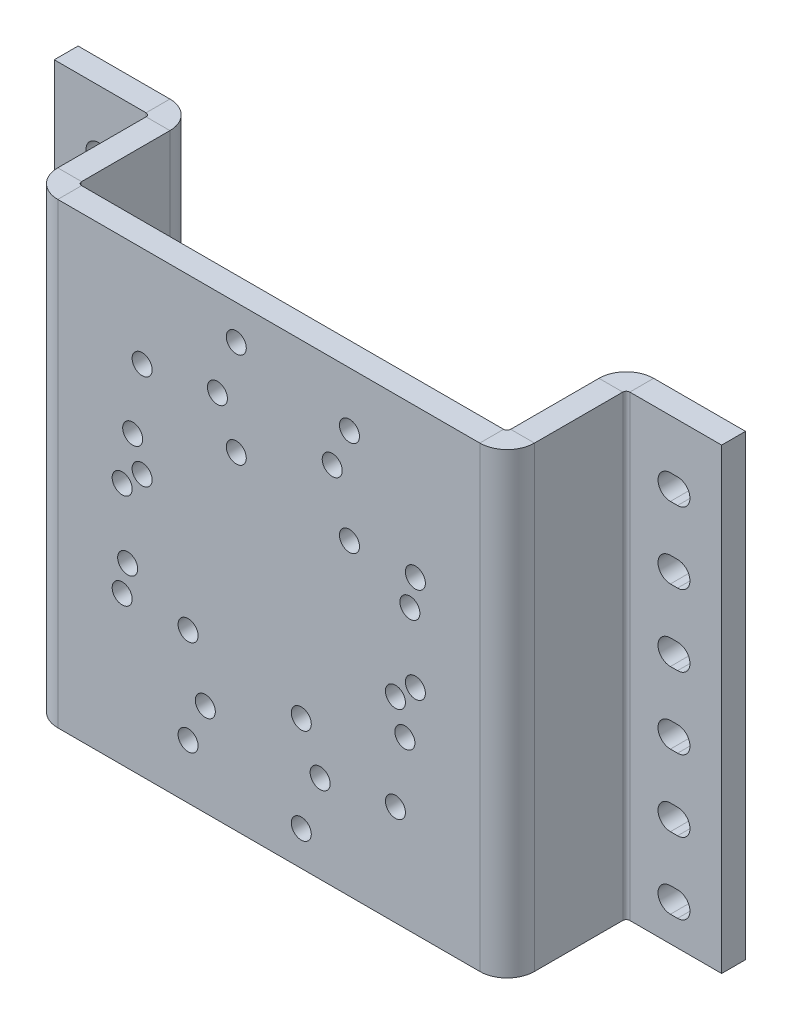
from build123d import *

# Parameters (mm, degrees)
ESBO_O1_W                      = 100
ESBO_O1_H                      = 96
FLANGE_BASE1_DEPTH             = 5
ARESTA_FLANGE1_STRIP_W         = 21.4732
ARESTA_FLANGE1_STRIP_H         = 5
ARESTA_FLANGE1_STRIP_CUT_DEPTH = 96
ARESTA_FLANGE1_DEPTH           = 96
ARESTA_FLANGE2_STRIP_W         = 21.4732
ARESTA_FLANGE2_STRIP_H         = 5
ARESTA_FLANGE2_STRIP_CUT_DEPTH = 96
ARESTA_FLANGE2_DEPTH           = 96
ARESTA_FLANGE3_STRIP_W         = 21.4732
ARESTA_FLANGE3_STRIP_H         = 5
ARESTA_FLANGE3_STRIP_CUT_DEPTH = 96
ARESTA_FLANGE3_DEPTH           = 96
ARESTA_FLANGE4_STRIP_W         = 21.4732
ARESTA_FLANGE4_STRIP_H         = 5
ARESTA_FLANGE4_STRIP_CUT_DEPTH = 96
ARESTA_FLANGE4_DEPTH           = 96
FURO_DE_DI_METRO_4_2_4_2_1_D   = 4.2
PADR_OCIRCULAR1_COUNT          = 8
FURO_DE_DI_METRO_4_2_4_2_2_D   = 4.2
PADR_OCIRCULAR2_COUNT          = 8
FURO_DE_DI_METRO_4_2_4_2_3_D   = 4.2
PADR_OCIRCULAR3_COUNT          = 8
CORTE_EXTRUS_O1_REACH          = 90.482
PADR_O_LINEAR2_COUNT           = 6
PADR_O_LINEAR2_PITCH           = 15
ESPELHAR2_COPY_1_REACH         = 90.482
ESPELHAR2_COPY_2_REACH         = 90.482
ESPELHAR2_COPY_3_REACH         = 90.482
ESPELHAR2_COPY_4_REACH         = 90.482
ESPELHAR2_COPY_5_REACH         = 90.482


# Sheet-metal steps are written as plain solids
with BuildPart() as part:
    # Esboço1 → Flange-base1 (new body)
    with BuildSketch(Plane.XY):
        Rectangle(ESBO_O1_W, ESBO_O1_H)
    extrude(amount=-FLANGE_BASE1_DEPTH)

    # Aresta-Flange1 strip (across the edge) → Aresta-Flange1 strip cut (cut)
    with BuildSketch(Plane(origin=(50, 48, -5), x_dir=(-1, 0, 0), z_dir=(0, -1, 0))):
        with Locations((-5, -2.5)):
            Rectangle(ARESTA_FLANGE1_STRIP_W, ARESTA_FLANGE1_STRIP_H)
    extrude(amount=ARESTA_FLANGE1_STRIP_CUT_DEPTH, mode=Mode.SUBTRACT)

    # Aresta-Flange1 section (across the edge) → Aresta-Flange1 (add)
    with BuildSketch(Plane(origin=(50, 48, -5), x_dir=(-1, 0, 0), z_dir=(0, -1, 0))):
        with BuildLine():
            Line((0, 0.7366), (0, 25))
            Line((0, 25), (5, 25))
            Line((5, 25), (5, 0.7366))
            ThreePointArc((5, 0.7366), (5.215745145, 0.215745145), (5.7366, 0))
            Line((5.7366, 0), (5.7366, -5))
            ThreePointArc((5.7366, -5), (1.680211239, -3.319788761), (0, 0.7366))
        make_face()
    extrude(amount=ARESTA_FLANGE1_DEPTH)

    # Aresta-Flange2 strip (across the edge) → Aresta-Flange2 strip cut (cut)
    with BuildSketch(Plane(origin=(50, -48, -30), x_dir=(0, 0, 1), z_dir=(0, 1, 0))):
        with Locations((-5, -2.5)):
            Rectangle(ARESTA_FLANGE2_STRIP_W, ARESTA_FLANGE2_STRIP_H)
    extrude(amount=ARESTA_FLANGE2_STRIP_CUT_DEPTH, mode=Mode.SUBTRACT)

    # Aresta-Flange2 section (across the edge) → Aresta-Flange2 (add)
    with BuildSketch(Plane(origin=(50, -48, -30), x_dir=(0, 0, 1), z_dir=(0, 1, 0))):
        with BuildLine():
            Line((0, 0.7366), (0, 20))
            Line((0, 20), (5, 20))
            Line((5, 20), (5, 0.7366))
            ThreePointArc((5, 0.7366), (5.215745145, 0.215745145), (5.7366, 0))
            Line((5.7366, 0), (5.7366, -5))
            ThreePointArc((5.7366, -5), (1.680211239, -3.319788761), (0, 0.7366))
        make_face()
    extrude(amount=ARESTA_FLANGE2_DEPTH)

    # Aresta-Flange3 strip (across the edge) → Aresta-Flange3 strip cut (cut)
    with BuildSketch(Plane(origin=(-50, -48, -5), x_dir=(1, 0, 0), z_dir=(0, 1, 0))):
        with Locations((-5, -2.5)):
            Rectangle(ARESTA_FLANGE3_STRIP_W, ARESTA_FLANGE3_STRIP_H)
    extrude(amount=ARESTA_FLANGE3_STRIP_CUT_DEPTH, mode=Mode.SUBTRACT)

    # Aresta-Flange3 section (across the edge) → Aresta-Flange3 (add)
    with BuildSketch(Plane(origin=(-50, -48, -5), x_dir=(1, 0, 0), z_dir=(0, 1, 0))):
        with BuildLine():
            Line((0, 0.7366), (0, 25))
            Line((0, 25), (5, 25))
            Line((5, 25), (5, 0.7366))
            ThreePointArc((5, 0.7366), (5.215745145, 0.215745145), (5.7366, 0))
            Line((5.7366, 0), (5.7366, -5))
            ThreePointArc((5.7366, -5), (1.680211239, -3.319788761), (0, 0.7366))
        make_face()
    extrude(amount=ARESTA_FLANGE3_DEPTH)

    # Aresta-Flange4 strip (across the edge) → Aresta-Flange4 strip cut (cut)
    with BuildSketch(Plane(origin=(-50, 48, -30), x_dir=(0, 0, 1), z_dir=(0, -1, 0))):
        with Locations((-5, -2.5)):
            Rectangle(ARESTA_FLANGE4_STRIP_W, ARESTA_FLANGE4_STRIP_H)
    extrude(amount=ARESTA_FLANGE4_STRIP_CUT_DEPTH, mode=Mode.SUBTRACT)

    # Aresta-Flange4 section (across the edge) → Aresta-Flange4 (add)
    with BuildSketch(Plane(origin=(-50, 48, -30), x_dir=(0, 0, 1), z_dir=(0, -1, 0))):
        with BuildLine():
            Line((0, 0.7366), (0, 20))
            Line((0, 20), (5, 20))
            Line((5, 20), (5, 0.7366))
            ThreePointArc((5, 0.7366), (5.215745145, 0.215745145), (5.7366, 0))
            Line((5.7366, 0), (5.7366, -5))
            ThreePointArc((5.7366, -5), (1.680211239, -3.319788761), (0, 0.7366))
        make_face()
    extrude(amount=ARESTA_FLANGE4_DEPTH)

    # Furo de diâmetro Ø4.2 (4.2)1 (through all)
    with Locations(Plane(origin=(-10.773634515, 29.600317555, 0), x_dir=(1, 0, 0), z_dir=(0, 0, 1))):
        with Locations((0, 0)):
            furo_de_di_metro_4_2_4_2_1 = Hole(FURO_DE_DI_METRO_4_2_4_2_1_D / 2)

    # PadrãoCircular1: Furo de diâmetro Ø4.2 (4.2)1 ×8 about axis
    padr_ocircular1_axis = Axis((0, 0, 0), (0, 0, 1))
    for i in range(1, PADR_OCIRCULAR1_COUNT):
        add(furo_de_di_metro_4_2_4_2_1.rotate(padr_ocircular1_axis, i * 360 / PADR_OCIRCULAR1_COUNT), mode=Mode.SUBTRACT)

    # Furo de diâmetro Ø4.2 (4.2)2 (through all)
    with Locations(Plane(origin=(-6.817847839, 40.753324224, 0), x_dir=(1, 0, 0), z_dir=(0, 0, 1))):
        with Locations((0, 0)):
            furo_de_di_metro_4_2_4_2_2 = Hole(FURO_DE_DI_METRO_4_2_4_2_2_D / 2)

    # PadrãoCircular2: Furo de diâmetro Ø4.2 (4.2)2 ×8 about axis
    padr_ocircular2_axis = Axis((0, 10, 0), (0, 0, 1))
    for i in range(1, PADR_OCIRCULAR2_COUNT):
        add(furo_de_di_metro_4_2_4_2_2.rotate(padr_ocircular2_axis, i * 360 / PADR_OCIRCULAR2_COUNT), mode=Mode.SUBTRACT)

    # Furo de diâmetro Ø4.2 (4.2)3 (through all)
    with Locations(Plane(origin=(-6.817847839, 20.753324224, 0), x_dir=(1, 0, 0), z_dir=(0, 0, 1))):
        with Locations((0, 0)):
            furo_de_di_metro_4_2_4_2_3 = Hole(FURO_DE_DI_METRO_4_2_4_2_3_D / 2)

    # PadrãoCircular3: Furo de diâmetro Ø4.2 (4.2)3 ×8 about axis
    padr_ocircular3_axis = Axis((0, -10, 0), (0, 0, 1))
    for i in range(1, PADR_OCIRCULAR3_COUNT):
        add(furo_de_di_metro_4_2_4_2_3.rotate(padr_ocircular3_axis, i * 360 / PADR_OCIRCULAR3_COUNT), mode=Mode.SUBTRACT)

    # Esboço24 → Corte-extrusão1 (cut, up to next)
    with BuildSketch(Plane.XY.offset(-25), mode=Mode.PRIVATE) as corte_extrus_o1_sk1:
        with BuildLine():
            Line((-60.75, -37.4), (-59.25, -37.4))
            ThreePointArc((-59.25, -37.4), (-56.65, -40), (-59.25, -42.6))
            Line((-59.25, -42.6), (-60.75, -42.6))
            ThreePointArc((-60.75, -42.6), (-63.35, -40), (-60.75, -37.4))
        make_face()
    corte_extrus_o1_tool1 = extrude(corte_extrus_o1_sk1.sketch, amount=-CORTE_EXTRUS_O1_REACH, mode=Mode.PRIVATE) & part.part
    corte_extrus_o1 = corte_extrus_o1_tool1.solids().sort_by_distance((-60, -40, -25))[0]
    add(corte_extrus_o1, mode=Mode.SUBTRACT)

    # Padrão linear2: Corte-extrusão1 ×6
    with Locations(*[(0, i * PADR_O_LINEAR2_PITCH, 0) for i in range(1, PADR_O_LINEAR2_COUNT)]):
        add(corte_extrus_o1, mode=Mode.SUBTRACT)

    # Espelhar2: Corte-extrusão1 across plane
    add(corte_extrus_o1.mirror(Plane(origin=(0, 0, 0), x_dir=(0, 0, 1), z_dir=(1, 0, 0))), mode=Mode.SUBTRACT)

    # Espelhar2 copy 1 sketch → Espelhar2 copy 1 (cut, up to next)
    with BuildSketch(Plane(origin=(0, 15, -25), x_dir=(-1, 0, 0), z_dir=(0, 0, 1)), mode=Mode.PRIVATE) as espelhar2_copy_1_sk1:
        with BuildLine():
            Line((-60.75, 37.4), (-59.25, 37.4))
            ThreePointArc((-59.25, 37.4), (-56.65, 40), (-59.25, 42.6))
            Line((-59.25, 42.6), (-60.75, 42.6))
            ThreePointArc((-60.75, 42.6), (-63.35, 40), (-60.75, 37.4))
        make_face()
    espelhar2_copy_1_tool1 = extrude(espelhar2_copy_1_sk1.sketch, amount=-ESPELHAR2_COPY_1_REACH, mode=Mode.PRIVATE) & part.part
    add(espelhar2_copy_1_tool1.solids().sort_by_distance((60, -25, -25))[0], mode=Mode.SUBTRACT)

    # Espelhar2 copy 2 sketch → Espelhar2 copy 2 (cut, up to next)
    with BuildSketch(Plane(origin=(0, 30, -25), x_dir=(-1, 0, 0), z_dir=(0, 0, 1)), mode=Mode.PRIVATE) as espelhar2_copy_2_sk1:
        with BuildLine():
            Line((-60.75, 37.4), (-59.25, 37.4))
            ThreePointArc((-59.25, 37.4), (-56.65, 40), (-59.25, 42.6))
            Line((-59.25, 42.6), (-60.75, 42.6))
            ThreePointArc((-60.75, 42.6), (-63.35, 40), (-60.75, 37.4))
        make_face()
    espelhar2_copy_2_tool1 = extrude(espelhar2_copy_2_sk1.sketch, amount=-ESPELHAR2_COPY_2_REACH, mode=Mode.PRIVATE) & part.part
    add(espelhar2_copy_2_tool1.solids().sort_by_distance((60, -10, -25))[0], mode=Mode.SUBTRACT)

    # Espelhar2 copy 3 sketch → Espelhar2 copy 3 (cut, up to next)
    with BuildSketch(Plane(origin=(0, 45, -25), x_dir=(-1, 0, 0), z_dir=(0, 0, 1)), mode=Mode.PRIVATE) as espelhar2_copy_3_sk1:
        with BuildLine():
            Line((-60.75, 37.4), (-59.25, 37.4))
            ThreePointArc((-59.25, 37.4), (-56.65, 40), (-59.25, 42.6))
            Line((-59.25, 42.6), (-60.75, 42.6))
            ThreePointArc((-60.75, 42.6), (-63.35, 40), (-60.75, 37.4))
        make_face()
    espelhar2_copy_3_tool1 = extrude(espelhar2_copy_3_sk1.sketch, amount=-ESPELHAR2_COPY_3_REACH, mode=Mode.PRIVATE) & part.part
    add(espelhar2_copy_3_tool1.solids().sort_by_distance((60, 5, -25))[0], mode=Mode.SUBTRACT)

    # Espelhar2 copy 4 sketch → Espelhar2 copy 4 (cut, up to next)
    with BuildSketch(Plane(origin=(0, 60, -25), x_dir=(-1, 0, 0), z_dir=(0, 0, 1)), mode=Mode.PRIVATE) as espelhar2_copy_4_sk1:
        with BuildLine():
            Line((-60.75, 37.4), (-59.25, 37.4))
            ThreePointArc((-59.25, 37.4), (-56.65, 40), (-59.25, 42.6))
            Line((-59.25, 42.6), (-60.75, 42.6))
            ThreePointArc((-60.75, 42.6), (-63.35, 40), (-60.75, 37.4))
        make_face()
    espelhar2_copy_4_tool1 = extrude(espelhar2_copy_4_sk1.sketch, amount=-ESPELHAR2_COPY_4_REACH, mode=Mode.PRIVATE) & part.part
    add(espelhar2_copy_4_tool1.solids().sort_by_distance((60, 20, -25))[0], mode=Mode.SUBTRACT)

    # Espelhar2 copy 5 sketch → Espelhar2 copy 5 (cut, up to next)
    with BuildSketch(Plane(origin=(0, 75, -25), x_dir=(-1, 0, 0), z_dir=(0, 0, 1)), mode=Mode.PRIVATE) as espelhar2_copy_5_sk1:
        with BuildLine():
            Line((-60.75, 37.4), (-59.25, 37.4))
            ThreePointArc((-59.25, 37.4), (-56.65, 40), (-59.25, 42.6))
            Line((-59.25, 42.6), (-60.75, 42.6))
            ThreePointArc((-60.75, 42.6), (-63.35, 40), (-60.75, 37.4))
        make_face()
    espelhar2_copy_5_tool1 = extrude(espelhar2_copy_5_sk1.sketch, amount=-ESPELHAR2_COPY_5_REACH, mode=Mode.PRIVATE) & part.part
    add(espelhar2_copy_5_tool1.solids().sort_by_distance((60, 35, -25))[0], mode=Mode.SUBTRACT)


solid = part.part
